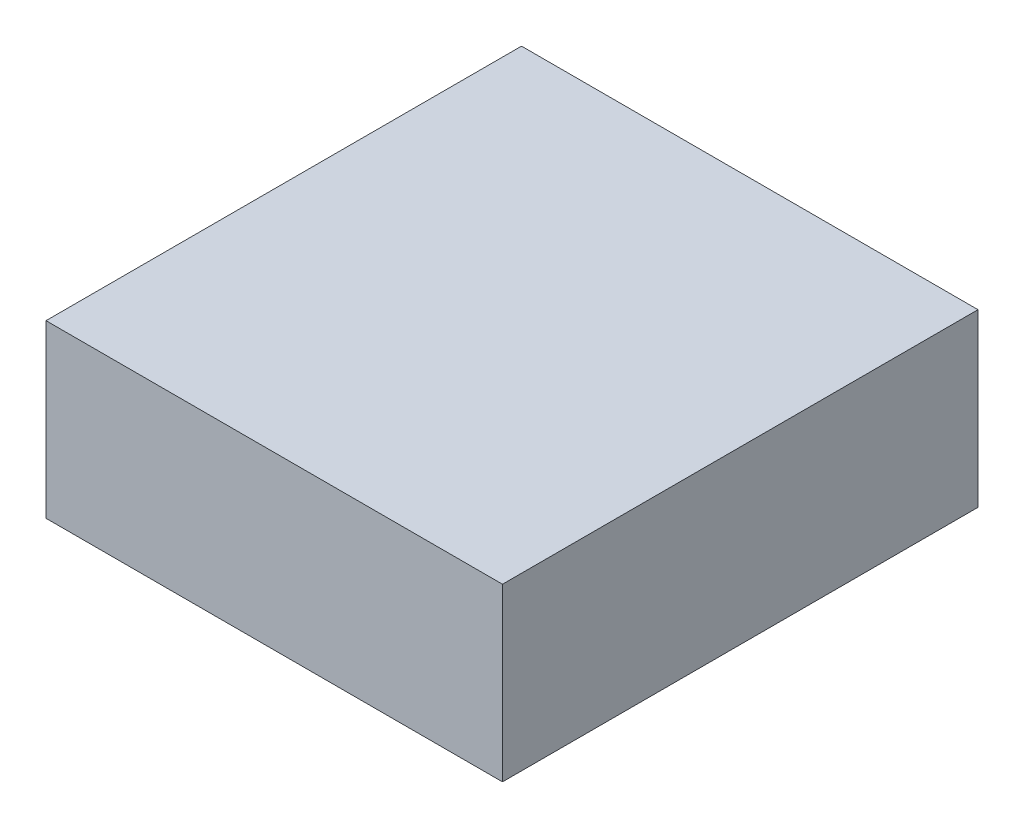
from build123d import *

# Parameters (mm, degrees)
SKETCH1_W           = 24
SKETCH1_H           = 25
BOSS_EXTRUDE1_DEPTH = 9


with BuildPart() as part:
    # Sketch1 → Boss-Extrude1 (new body)
    with BuildSketch(Plane(origin=(0, 0, 0), x_dir=(1, 0, 0), z_dir=(0, 1, 0))):
        Rectangle(SKETCH1_W, SKETCH1_H)
    extrude(amount=BOSS_EXTRUDE1_DEPTH)


solid = part.part
